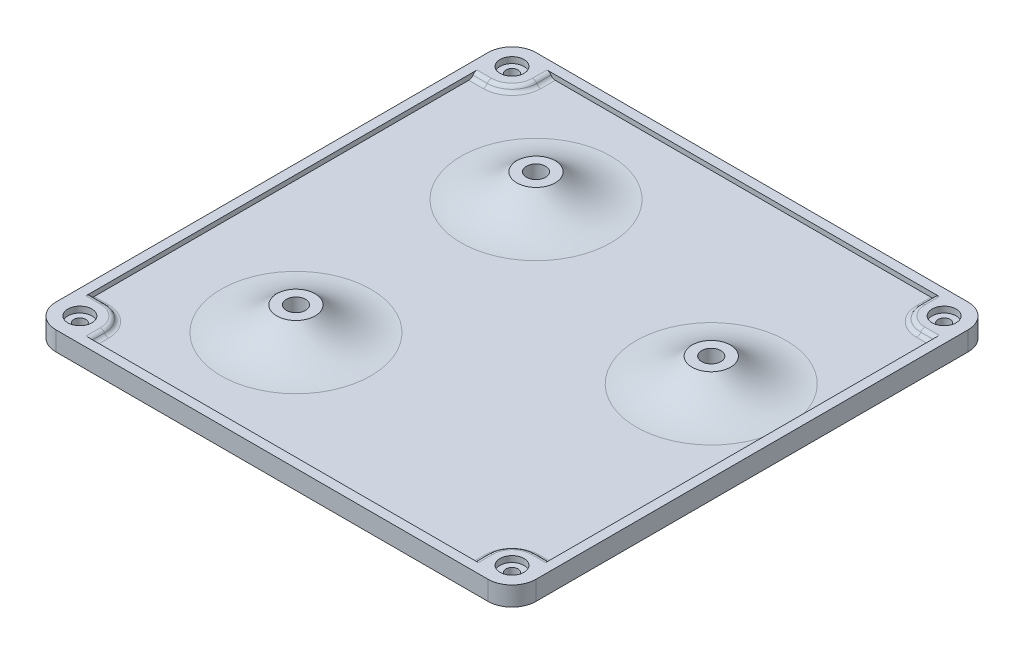
from build123d import *

# Parameters (mm, degrees)
SKETCH1_W            = 100
SKETCH1_H            = 100
BOSS_EXTRUDE1_DEPTH  = 4
SKETCH2_W            = 96
SKETCH2_H            = 96
CUT_EXTRUDE1_DEPTH   = 1
SKETCH7_W            = 8
SKETCH7_H            = 8
BOSS_EXTRUDE4_DEPTH  = 1
SKETCH9_W            = 8
SKETCH9_H            = 8
BOSS_EXTRUDE5_DEPTH  = 1
SKETCH10_W           = 8
SKETCH10_H           = 8
BOSS_EXTRUDE6_DEPTH  = 1
SKETCH11_W           = 8
SKETCH11_H           = 8
BOSS_EXTRUDE7_DEPTH  = 1
FILLET8_R            = 5
FILLET9_R            = 5
FILLET10_R           = 5
FILLET11_R           = 5
FILLET12_R           = 5
FILLET13_R           = 5
FILLET14_R           = 5
FILLET15_R           = 5
FILLET18_R           = 1
FILLET19_R           = 1
FILLET20_R           = 1
FILLET21_R           = 1
FILLET22_R           = 1
FILLET23_R           = 1
FILLET24_R           = 1
FILLET25_R           = 1
SKETCH15_R           = 2.5
CUT_EXTRUDE7_DEPTH   = 1.25
CUT_EXTRUDE8_START   = -1.25
SKETCH16_R           = 2.5
CUT_EXTRUDE8_DEPTH   = 1.25
SKETCH17_R           = 1.1
CUT_EXTRUDE9_DEPTH   = 1.5
SKETCH18_R           = 2.5
CUT_EXTRUDE10_DEPTH  = 1.25
CUT_EXTRUDE11_START  = -1.25
SKETCH19_R           = 2.5
CUT_EXTRUDE11_DEPTH  = 1.25
SKETCH20_R           = 1.05
CUT_EXTRUDE12_DEPTH  = 71.764132864
SKETCH21_R           = 2.5
CUT_EXTRUDE13_DEPTH  = 1.25
CUT_EXTRUDE14_START  = -1.25
SKETCH23_R           = 2.5
CUT_EXTRUDE14_DEPTH  = 1.25
SKETCH24_R           = 1.05
CUT_EXTRUDE15_DEPTH  = 71.764132864
SKETCH25_R           = 2.5
CUT_EXTRUDE16_DEPTH  = 1.25
CUT_EXTRUDE17_START  = -1.25
SKETCH26_R           = 2.5
CUT_EXTRUDE17_DEPTH  = 1.25
SKETCH27_R           = 1.05
CUT_EXTRUDE18_DEPTH  = 71.764132864
SKETCH28_R           = 4
BOSS_EXTRUDE9_DEPTH  = 5
SKETCH31_R           = 4
BOSS_EXTRUDE10_DEPTH = 5
SKETCH33_R           = 4
BOSS_EXTRUDE11_DEPTH = 5
SKETCH39_R           = 2
CUT_EXTRUDE22_DEPTH  = 5.45
SKETCH40_R           = 2
CUT_EXTRUDE23_DEPTH  = 5.45
SKETCH41_R           = 2
CUT_EXTRUDE24_DEPTH  = 5.45
FILLET27_R           = 16
SKETCH42_R           = 1.25
CUT_EXTRUDE25_DEPTH  = 71.905306579
SKETCH43_R           = 1.25
CUT_EXTRUDE26_DEPTH  = 71.905306579
SKETCH44_R           = 1.25
CUT_EXTRUDE27_DEPTH  = 71.905306579
SKETCH45_R           = 1.25
CUT_EXTRUDE28_DEPTH  = 71.905306579


# Some blends are built 0.0001 mm under size
with BuildPart() as part:
    # Sketch1 → Boss-Extrude1 (new body)
    with BuildSketch(Plane(origin=(0, 0, 0), x_dir=(1, 0, 0), z_dir=(0, 1, 0))):
        Rectangle(SKETCH1_W, SKETCH1_H)
    extrude(amount=BOSS_EXTRUDE1_DEPTH)

    # Sketch2 → Cut-Extrude1 (cut)
    with BuildSketch(Plane(origin=(0, 4, 0), x_dir=(1, 0, 0), z_dir=(0, 1, 0))):
        Rectangle(SKETCH2_W, SKETCH2_H)
    extrude(amount=-CUT_EXTRUDE1_DEPTH, mode=Mode.SUBTRACT)

    # Sketch7 → Boss-Extrude4 (add)
    with BuildSketch(Plane(origin=(0, 3, 0), x_dir=(1, 0, 0), z_dir=(0, 1, 0))):
        with Locations((-44, 44)):
            Rectangle(SKETCH7_W, SKETCH7_H)
    extrude(amount=BOSS_EXTRUDE4_DEPTH)

    # Sketch9 → Boss-Extrude5 (add)
    with BuildSketch(Plane(origin=(0, 3, 0), x_dir=(1, 0, 0), z_dir=(0, 1, 0))):
        with Locations((44, 44)):
            Rectangle(SKETCH9_W, SKETCH9_H)
    extrude(amount=BOSS_EXTRUDE5_DEPTH)

    # Sketch10 → Boss-Extrude6 (add)
    with BuildSketch(Plane(origin=(0, 3, 0), x_dir=(1, 0, 0), z_dir=(0, 1, 0))):
        with Locations((-44, -44)):
            Rectangle(SKETCH10_W, SKETCH10_H)
    extrude(amount=BOSS_EXTRUDE6_DEPTH)

    # Sketch11 → Boss-Extrude7 (add)
    with BuildSketch(Plane(origin=(0, 3, 0), x_dir=(1, 0, 0), z_dir=(0, 1, 0))):
        with Locations((44, -44)):
            Rectangle(SKETCH11_W, SKETCH11_H)
    extrude(amount=BOSS_EXTRUDE7_DEPTH)

    # Fillet8
    fillet8_edges = [part.edges().sort_by_distance(p)[0] for p in [
        (-40, 3.5, -40),
    ]]
    fillet(fillet8_edges, radius=FILLET8_R)

    # Fillet9
    fillet9_edges = [part.edges().sort_by_distance(p)[0] for p in [
        (-40, 3.5, 40),
    ]]
    fillet(fillet9_edges, radius=FILLET9_R)

    # Fillet10
    fillet10_edges = [part.edges().sort_by_distance(p)[0] for p in [
        (40, 3.5, 40),
    ]]
    fillet(fillet10_edges, radius=FILLET10_R)

    # Fillet11
    fillet11_edges = [part.edges().sort_by_distance(p)[0] for p in [
        (40, 3.5, -40),
    ]]
    fillet(fillet11_edges, radius=FILLET11_R)

    # Fillet12
    fillet12_edges = [part.edges().sort_by_distance(p)[0] for p in [
        (50, 2, -50),
    ]]
    fillet(fillet12_edges, radius=FILLET12_R)

    # Fillet13
    fillet13_edges = [part.edges().sort_by_distance(p)[0] for p in [
        (50, 2, 50),
    ]]
    fillet(fillet13_edges, radius=FILLET13_R)

    # Fillet14
    fillet14_edges = [part.edges().sort_by_distance(p)[0] for p in [
        (-50, 2, 50),
    ]]
    fillet(fillet14_edges, radius=FILLET14_R)

    # Fillet15
    fillet15_edges = [part.edges().sort_by_distance(p)[0] for p in [
        (-50, 2, -50),
    ]]
    fillet(fillet15_edges, radius=FILLET15_R)

    # Fillet18
    fillet18_edges = [part.edges().sort_by_distance(p)[0] for p in [
        (-40, 3, -46.5),
        (-46.5, 3, -40),
        (-41.464466094, 3, -41.464466094),
    ]]
    fillet(fillet18_edges, radius=FILLET18_R - 0.0001)  # a hair under: the kernel refuses the full size

    # Fillet19
    # the kernel refuses this fillet: 1 mm, written as the material it takes off along each edge
    with BuildSketch(Plane(origin=(-45, 4, -40), x_dir=(0, 0, -1), z_dir=(-1, 0, 0))) as fillet19_piece_1:
        with BuildLine():
            CenterArc((0.732093072, 1), FILLET19_R, 209.998345944, 60.001654056)
            Line((-0.133946766, 0.500025001), (-0.22055075, 0.450027501))
            ThreePointArc((-0.22055075, 0.450027501), (-0.1, 0.0001), (-0.1, 0))
            Line((-0.1, 0), (0, -0.1))
            Line((0, -0.1), (0.732093072, -0.1))
            Line((0.732093072, -0.1), (0.732093072, 0))
        make_face()
    extrude(amount=3, mode=Mode.SUBTRACT)
    with BuildSketch(Plane(origin=(-40, 4, -48), x_dir=(0.2587568099374835, -0.9659425000024469, 0), z_dir=(0, 0, 1))) as fillet19_piece_2:
        with BuildLine():
            CenterArc((0.776508432, -0.965916622), FILLET19_R, 105.002037513, 60.001654056)
            Line((-0.189434068, -0.707159812), (-0.286028318, -0.681284131))
            Line((-0.286028318, -0.681284131), (-0.09659425, 0.025875681))
            Line((-0.09659425, 0.025875681), (0.025875681, 0.09659425))
            ThreePointArc((0.025875681, 0.09659425), (0.025972275, 0.096568374), (0.491769698, 0.096591662))
            Line((0.491769698, 0.096591662), (0.517655038, 0))
        make_face()
    extrude(amount=3, mode=Mode.SUBTRACT)
    with BuildSketch(Plane(origin=(-45, 4, -45), x_dir=(0, 0, 1), z_dir=(-1, 0, 0))) as fillet19_piece_3:
        with BuildLine():
            CenterArc((4.267906928, -1), FILLET19_R, 29.998345944, 60.001654056)
            Line((5.133946766, -0.500025001), (5.22055075, -0.450027501))
            ThreePointArc((5.22055075, -0.450027501), (5.1, -0.0001), (5.1, 0))
            Line((5.1, 0), (5, 0.1))
            Line((5, 0.1), (4.267906928, 0.1))
            Line((4.267906928, 0.1), (4.267906928, 0))
        make_face()
    revolve(axis=Axis((-45, 4, -45), (0, 1, 0)), revolution_arc=90, mode=Mode.SUBTRACT)

    # Fillet20
    fillet20_edges = [part.edges().sort_by_distance(p)[0] for p in [
        (40, 4, -46.5),
        (46.5, 4, -40),
        (41.464466094, 4, -41.464466094),
    ]]
    fillet(fillet20_edges, radius=FILLET20_R - 0.0001)  # a hair under: the kernel refuses the full size

    # Fillet21
    fillet21_edges = [part.edges().sort_by_distance(p)[0] for p in [
        (46.5, 3, -40),
        (41.464466094, 3, -41.464466094),
        (40, 3, -46.5),
    ]]
    fillet(fillet21_edges, radius=FILLET21_R)

    # Fillet22
    fillet22_edges = [part.edges().sort_by_distance(p)[0] for p in [
        (-46.5, 3, 40),
        (-40, 3, 46.5),
        (-41.464466094, 3, 41.464466094),
    ]]
    fillet(fillet22_edges, radius=FILLET22_R - 0.0001)  # a hair under: the kernel refuses the full size

    # Fillet23
    # the kernel refuses this fillet: 1 mm, written as the material it takes off along each edge
    with BuildSketch(Plane(origin=(-40, 4, 48), x_dir=(-1, 0, 0), z_dir=(0, 0, -1))) as fillet23_piece_1:
        with BuildLine():
            CenterArc((0.732093072, -1), FILLET23_R, 90, 60.001654056)
            Line((-0.133946766, -0.500025001), (-0.22055075, -0.450027501))
            ThreePointArc((-0.22055075, -0.450027501), (-0.1, -0.0001), (-0.1, 0))
            Line((-0.1, 0), (0, 0.1))
            Line((0, 0.1), (0.732093072, 0.1))
            Line((0.732093072, 0.1), (0.732093072, 0))
        make_face()
    extrude(amount=3, mode=Mode.SUBTRACT)
    with BuildSketch(Plane(origin=(-45, 4, 40), x_dir=(0, -0.9659425000024469, -0.2587568099374835), z_dir=(-1, 0, 0))) as fillet23_piece_2:
        with BuildLine():
            CenterArc((0.776508432, 0.965916622), FILLET23_R, 194.996308431, 60.001654056)
            Line((-0.189434068, 0.707159812), (-0.286028318, 0.681284131))
            Line((-0.286028318, 0.681284131), (-0.09659425, -0.025875681))
            Line((-0.09659425, -0.025875681), (0.025875681, -0.09659425))
            ThreePointArc((0.025875681, -0.09659425), (0.025972275, -0.096568374), (0.491769698, -0.096591662))
            Line((0.491769698, -0.096591662), (0.517655038, 0))
        make_face()
    extrude(amount=3, mode=Mode.SUBTRACT)
    with BuildSketch(Plane(origin=(-45, 4, 45), x_dir=(0, 0, -1), z_dir=(-1, 0, 0))) as fillet23_piece_3:
        with BuildLine():
            CenterArc((4.267906928, 1), FILLET23_R, 270, 60.001654056)
            Line((5.133946766, 0.500025001), (5.22055075, 0.450027501))
            ThreePointArc((5.22055075, 0.450027501), (5.1, 0.0001), (5.1, 0))
            Line((5.1, 0), (5, -0.1))
            Line((5, -0.1), (4.267906928, -0.1))
            Line((4.267906928, -0.1), (4.267906928, 0))
        make_face()
    revolve(axis=Axis((-45, 4, 45), (0, -1, 0)), revolution_arc=90, mode=Mode.SUBTRACT)

    # Fillet24
    fillet24_edges = [part.edges().sort_by_distance(p)[0] for p in [
        (46.5, 4, 40),
        (40, 4, 46.5),
        (41.464466094, 4, 41.464466094),
    ]]
    fillet(fillet24_edges, radius=FILLET24_R - 0.0001)  # a hair under: the kernel refuses the full size

    # Fillet25
    fillet25_edges = [part.edges().sort_by_distance(p)[0] for p in [
        (40, 3, 46.5),
        (41.464466094, 3, 41.464466094),
        (46.5, 3, 40),
    ]]
    fillet(fillet25_edges, radius=FILLET25_R)

    # Sketch15 → Cut-Extrude7 (cut)
    with BuildSketch(Plane(origin=(0, 4, 0), x_dir=(1, 0, 0), z_dir=(0, 1, 0))):
        with Locations(Location((-45, 45, 0), (0, 0, 270))):
            Circle(SKETCH15_R)
    extrude(amount=-CUT_EXTRUDE7_DEPTH, mode=Mode.SUBTRACT)

    # Sketch16 → Cut-Extrude8 (cut)
    with BuildSketch(Plane.XZ.offset(CUT_EXTRUDE8_START)):
        with Locations(Location((-45, -45, 0), (0, 0, 90))):
            Circle(SKETCH16_R)
    extrude(amount=CUT_EXTRUDE8_DEPTH, mode=Mode.SUBTRACT)

    # Sketch17 → Cut-Extrude9 (cut)
    with BuildSketch(Plane(origin=(0, 2.75, 0), x_dir=(1, 0, 0), z_dir=(0, 1, 0))):
        with Locations(Location((-45, 45, 0), (0, 0, 270))):
            Circle(SKETCH17_R)
    extrude(amount=-CUT_EXTRUDE9_DEPTH, mode=Mode.SUBTRACT)

    # Sketch18 → Cut-Extrude10 (cut)
    with BuildSketch(Plane(origin=(0, 4, 0), x_dir=(1, 0, 0), z_dir=(0, 1, 0))):
        with Locations(Location((45, 45, 0), (0, 0, 270))):
            Circle(SKETCH18_R)
    extrude(amount=-CUT_EXTRUDE10_DEPTH, mode=Mode.SUBTRACT)

    # Sketch19 → Cut-Extrude11 (cut)
    with BuildSketch(Plane.XZ.offset(CUT_EXTRUDE11_START)):
        with Locations(Location((45, -45, 0), (0, 0, 90))):
            Circle(SKETCH19_R)
    extrude(amount=CUT_EXTRUDE11_DEPTH, mode=Mode.SUBTRACT)

    # Sketch20 → Cut-Extrude12 (cut, through all)
    with BuildSketch(Plane(origin=(0, 2.75, 0), x_dir=(1, 0, 0), z_dir=(0, 1, 0))):
        with Locations(Location((45, 45, 0), (0, 0, 270))):
            Circle(SKETCH20_R)
    extrude(amount=-CUT_EXTRUDE12_DEPTH, mode=Mode.SUBTRACT)

    # Sketch21 → Cut-Extrude13 (cut)
    with BuildSketch(Plane(origin=(0, 4, 0), x_dir=(1, 0, 0), z_dir=(0, 1, 0))):
        with Locations(Location((-45, -45, 0), (0, 0, 270))):
            Circle(SKETCH21_R)
    extrude(amount=-CUT_EXTRUDE13_DEPTH, mode=Mode.SUBTRACT)

    # Sketch23 → Cut-Extrude14 (cut)
    with BuildSketch(Plane(origin=(0, 0, 0), x_dir=(-1, 0, 0), z_dir=(0, -1, 0)).offset(CUT_EXTRUDE14_START)):
        with Locations(Location((45, -45, 0), (0, 0, 270))):
            Circle(SKETCH23_R)
    extrude(amount=CUT_EXTRUDE14_DEPTH, mode=Mode.SUBTRACT)

    # Sketch24 → Cut-Extrude15 (cut, through all)
    with BuildSketch(Plane(origin=(0, 2.75, 0), x_dir=(1, 0, 0), z_dir=(0, 1, 0))):
        with Locations(Location((-45, -45, 0), (0, 0, 270))):
            Circle(SKETCH24_R)
    extrude(amount=-CUT_EXTRUDE15_DEPTH, mode=Mode.SUBTRACT)

    # Sketch25 → Cut-Extrude16 (cut)
    with BuildSketch(Plane.XZ):
        with Locations(Location((45, 45, 0), (0, 0, 270))):
            Circle(SKETCH25_R)
    extrude(amount=-CUT_EXTRUDE16_DEPTH, mode=Mode.SUBTRACT)

    # Sketch26 → Cut-Extrude17 (cut)
    with BuildSketch(Plane(origin=(0, 4, 0), x_dir=(1, 0, 0), z_dir=(0, 1, 0)).offset(CUT_EXTRUDE17_START)):
        with Locations(Location((45, -45, 0), (0, 0, 90))):
            Circle(SKETCH26_R)
    extrude(amount=CUT_EXTRUDE17_DEPTH, mode=Mode.SUBTRACT)

    # Sketch27 → Cut-Extrude18 (cut, through all)
    with BuildSketch(Plane(origin=(0, 2.75, 0), x_dir=(1, 0, 0), z_dir=(0, 1, 0))):
        with Locations(Location((45, -45, 0), (0, 0, 270))):
            Circle(SKETCH27_R)
    extrude(amount=-CUT_EXTRUDE18_DEPTH, mode=Mode.SUBTRACT)

    # Sketch28 → Boss-Extrude9 (add)
    with BuildSketch(Plane(origin=(0, 3, 0), x_dir=(1, 0, 0), z_dir=(0, 1, 0))):
        with Locations(Location((-19.5, 24.5, 0), (0, 0, 90))):
            Circle(SKETCH28_R)
    extrude(amount=BOSS_EXTRUDE9_DEPTH)

    # Sketch31 → Boss-Extrude10 (add)
    with BuildSketch(Plane(origin=(0, 3, 0), x_dir=(1, 0, 0), z_dir=(0, 1, 0))):
        with Locations(Location((-20.5, -24.5, 0), (0, 0, 90))):
            Circle(SKETCH31_R)
    extrude(amount=BOSS_EXTRUDE10_DEPTH)

    # Sketch33 → Boss-Extrude11 (add)
    with BuildSketch(Plane(origin=(0, 3, 0), x_dir=(1, 0, 0), z_dir=(0, 1, 0))):
        with Locations(Location((32, 9.5, 0), (0, 0, 90))):
            Circle(SKETCH33_R)
    extrude(amount=BOSS_EXTRUDE11_DEPTH)

    # Sketch39 → Cut-Extrude22 (cut)
    with BuildSketch(Plane(origin=(0, 8, 0), x_dir=(1, 0, 0), z_dir=(0, 1, 0))):
        with Locations(Location((-19.5, 24.5, 0), (0, 0, 270))):
            Circle(SKETCH39_R)
    extrude(amount=-CUT_EXTRUDE22_DEPTH, mode=Mode.SUBTRACT)

    # Sketch40 → Cut-Extrude23 (cut)
    with BuildSketch(Plane(origin=(0, 8, 0), x_dir=(1, 0, 0), z_dir=(0, 1, 0))):
        with Locations(Location((32, 9.5, 0), (0, 0, 270))):
            Circle(SKETCH40_R)
    extrude(amount=-CUT_EXTRUDE23_DEPTH, mode=Mode.SUBTRACT)

    # Sketch41 → Cut-Extrude24 (cut)
    with BuildSketch(Plane(origin=(0, 8, 0), x_dir=(1, 0, 0), z_dir=(0, 1, 0))):
        with Locations(Location((-20.5, -24.5, 0), (0, 0, 270))):
            Circle(SKETCH41_R)
    extrude(amount=-CUT_EXTRUDE24_DEPTH, mode=Mode.SUBTRACT)

    # Fillet27
    # the kernel refuses this fillet: 16 mm, written as the material it adds along each edge
    with BuildSketch(Plane(origin=(-19.5, 3, -24.5), x_dir=(0, 0, -1), z_dir=(1, 0, 0))) as fillet27_piece_1:
        with BuildLine():
            CenterArc((15.618950039, 16), FILLET27_R, 223.432536558, 46.567463442)
            Line((4, 5), (3.767620999, 4.78))
            ThreePointArc((3.767620999, 4.78), (3.68, 2.5), (3.68, 0))
            Line((3.68, 0), (4, -0.32))
            Line((4, -0.32), (15.618950039, -0.32))
            Line((15.618950039, -0.32), (15.618950039, 0))
        make_face()
    revolve(axis=Axis((-19.5, 3, -24.5), (0, 1, 0)))
    with BuildSketch(Plane(origin=(-20.5, 3, 24.5), x_dir=(0, 0, -1), z_dir=(1, 0, 0))) as fillet27_piece_2:
        with BuildLine():
            CenterArc((15.618950039, 16), FILLET27_R, 223.432536558, 46.567463442)
            Line((4, 5), (3.767620999, 4.78))
            ThreePointArc((3.767620999, 4.78), (3.68, 2.5), (3.68, 0))
            Line((3.68, 0), (4, -0.32))
            Line((4, -0.32), (15.618950039, -0.32))
            Line((15.618950039, -0.32), (15.618950039, 0))
        make_face()
    revolve(axis=Axis((-20.5, 3, 24.5), (0, 1, 0)))
    with BuildSketch(Plane(origin=(32, 3, -9.5), x_dir=(0, 0, -1), z_dir=(1, 0, 0))) as fillet27_piece_3:
        with BuildLine():
            CenterArc((15.618950039, 16), FILLET27_R, 223.432536558, 46.567463442)
            Line((4, 5), (3.767620999, 4.78))
            ThreePointArc((3.767620999, 4.78), (3.68, 2.5), (3.68, 0))
            Line((3.68, 0), (4, -0.32))
            Line((4, -0.32), (15.618950039, -0.32))
            Line((15.618950039, -0.32), (15.618950039, 0))
        make_face()
    revolve(axis=Axis((32, 3, -9.5), (0, 1, 0)))

    # Sketch42 → Cut-Extrude25 (cut, through all)
    with BuildSketch(Plane(origin=(0, 2.75, 0), x_dir=(1, 0, 0), z_dir=(0, 1, 0))):
        with Locations(Location((45, -45, 0), (0, 0, 270))):
            Circle(SKETCH42_R)
    extrude(amount=-CUT_EXTRUDE25_DEPTH, mode=Mode.SUBTRACT)

    # Sketch43 → Cut-Extrude26 (cut, through all)
    with BuildSketch(Plane(origin=(0, 2.75, 0), x_dir=(1, 0, 0), z_dir=(0, 1, 0))):
        with Locations(Location((-45, 45, 0), (0, 0, 270))):
            Circle(SKETCH43_R)
    extrude(amount=-CUT_EXTRUDE26_DEPTH, mode=Mode.SUBTRACT)

    # Sketch44 → Cut-Extrude27 (cut, through all)
    with BuildSketch(Plane(origin=(0, 2.75, 0), x_dir=(1, 0, 0), z_dir=(0, 1, 0))):
        with Locations(Location((-45, -45, 0), (0, 0, 270))):
            Circle(SKETCH44_R)
    extrude(amount=-CUT_EXTRUDE27_DEPTH, mode=Mode.SUBTRACT)

    # Sketch45 → Cut-Extrude28 (cut, through all)
    with BuildSketch(Plane(origin=(0, 2.75, 0), x_dir=(1, 0, 0), z_dir=(0, 1, 0))):
        with Locations(Location((45, 45, 0), (0, 0, 270))):
            Circle(SKETCH45_R)
    extrude(amount=-CUT_EXTRUDE28_DEPTH, mode=Mode.SUBTRACT)


solid = part.part
